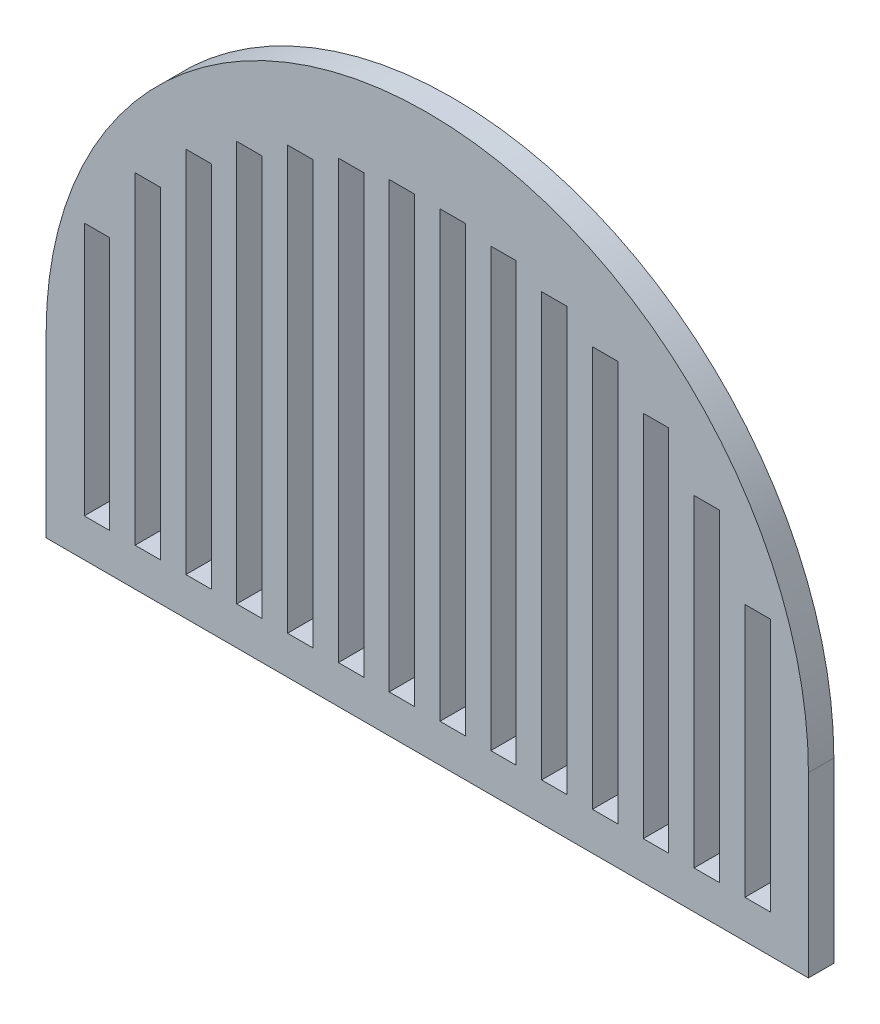
from build123d import *

# Parameters (mm, degrees)
P_IDAT_VYSUNUT_M1_DEPTH  = 10
ODEBRAT_VYSUNUT_M1_REACH = 374.156
SKICA2_W                 = 10
SKICA2_H                 = 99.833147735
LINPOLE2_START           = 15
LINPOLE2_OUTLINE_W       = 10
LINPOLE2_OUTLINE_H       = 10
LINPOLE2_DEPTH           = 126.980390272
LINPOLE2_START_2         = 141.980390272
LINPOLE2_2_OUTLINE_W     = 10
LINPOLE2_2_OUTLINE_H     = 10
LINPOLE2_2_DEPTH         = 30.684601342
LINPOLE2_3_OUTLINE_W     = 10
LINPOLE2_3_OUTLINE_H     = 10
LINPOLE2_3_DEPTH         = 99.833147735
LINPOLE2_START_3         = 172.664991614
LINPOLE2_4_OUTLINE_W     = 10
LINPOLE2_4_OUTLINE_H     = 10
LINPOLE2_4_DEPTH         = 14.304392953
LINPOLE2_5_OUTLINE_W     = 10
LINPOLE2_5_OUTLINE_H     = 10
LINPOLE2_5_DEPTH         = 18.019609728
LINPOLE2_6_OUTLINE_W     = 10
LINPOLE2_6_OUTLINE_H     = 10
LINPOLE2_6_DEPTH         = 8.756364623
LINPOLE2_START_4         = 186.969384567
LINPOLE2_7_OUTLINE_W     = 10
LINPOLE2_7_OUTLINE_H     = 10
LINPOLE2_7_DEPTH         = 2.696910904


# Read off the part's stored shape, not the designer's step: LinPole2
with BuildPart() as part:
    # Skica1 → Přidat vysunutím1 (new body)
    with BuildSketch(Plane.XY):
        with BuildLine():
            Line((0, 0), (0, 70))
            ThreePointArc((0, 70), (150, 220), (300, 70))
            Line((300, 70), (300, 0))
            Line((300, 0), (0, 0))
        make_face()
    extrude(amount=P_IDAT_VYSUNUT_M1_DEPTH)

    # Skica2 → Odebrat vysunutím1 (cut, up to next)
    with BuildSketch(Plane(origin=(0, 0, 0), x_dir=(-1, 0, 0), z_dir=(0, 0, -1)), mode=Mode.PRIVATE) as odebrat_vysunut_m1_sk1:
        with Locations((-280, 64.916573868)):
            Rectangle(SKICA2_W, SKICA2_H)
    odebrat_vysunut_m1_tool1 = extrude(odebrat_vysunut_m1_sk1.sketch, amount=-ODEBRAT_VYSUNUT_M1_REACH, mode=Mode.PRIVATE) & part.part
    add(odebrat_vysunut_m1_tool1.solids().sort_by_distance((280, 64.916574, 0))[0], mode=Mode.SUBTRACT)

    # LinPole2 outline → LinPole2 (cut)
    with BuildSketch(Plane(origin=(0, 0, 0), x_dir=(1, 0, 0), z_dir=(0, 1, 0)).offset(LINPOLE2_START)):
        with Locations((40, -5)):
            Rectangle(LINPOLE2_OUTLINE_W, LINPOLE2_OUTLINE_H)
        with Locations((60, -5)):
            Rectangle(LINPOLE2_OUTLINE_W, LINPOLE2_OUTLINE_H)
        with Locations((80, -5)):
            Rectangle(LINPOLE2_OUTLINE_W, LINPOLE2_OUTLINE_H)
        with Locations((100, -5)):
            Rectangle(LINPOLE2_OUTLINE_W, LINPOLE2_OUTLINE_H)
        with Locations((120, -5)):
            Rectangle(LINPOLE2_OUTLINE_W, LINPOLE2_OUTLINE_H)
        with Locations((140, -5)):
            Rectangle(LINPOLE2_OUTLINE_W, LINPOLE2_OUTLINE_H)
        with Locations((160, -5)):
            Rectangle(LINPOLE2_OUTLINE_W, LINPOLE2_OUTLINE_H)
        with Locations((180, -5)):
            Rectangle(LINPOLE2_OUTLINE_W, LINPOLE2_OUTLINE_H)
        with Locations((200, -5)):
            Rectangle(LINPOLE2_OUTLINE_W, LINPOLE2_OUTLINE_H)
        with Locations((220, -5)):
            Rectangle(LINPOLE2_OUTLINE_W, LINPOLE2_OUTLINE_H)
        with Locations((240, -5)):
            Rectangle(LINPOLE2_OUTLINE_W, LINPOLE2_OUTLINE_H)
        with Locations((260, -5)):
            Rectangle(LINPOLE2_OUTLINE_W, LINPOLE2_OUTLINE_H)
    extrude(amount=LINPOLE2_DEPTH, mode=Mode.SUBTRACT)

    # LinPole2 2 outline → LinPole2 2 (cut)
    with BuildSketch(Plane(origin=(0, 0, 0), x_dir=(1, 0, 0), z_dir=(0, 1, 0)).offset(LINPOLE2_START_2)):
        with Locations((80, -5)):
            Rectangle(LINPOLE2_2_OUTLINE_W, LINPOLE2_2_OUTLINE_H)
        with Locations((100, -5)):
            Rectangle(LINPOLE2_2_OUTLINE_W, LINPOLE2_2_OUTLINE_H)
        with Locations((120, -5)):
            Rectangle(LINPOLE2_2_OUTLINE_W, LINPOLE2_2_OUTLINE_H)
        with Locations((140, -5)):
            Rectangle(LINPOLE2_2_OUTLINE_W, LINPOLE2_2_OUTLINE_H)
        with Locations((160, -5)):
            Rectangle(LINPOLE2_2_OUTLINE_W, LINPOLE2_2_OUTLINE_H)
        with Locations((180, -5)):
            Rectangle(LINPOLE2_2_OUTLINE_W, LINPOLE2_2_OUTLINE_H)
        with Locations((200, -5)):
            Rectangle(LINPOLE2_2_OUTLINE_W, LINPOLE2_2_OUTLINE_H)
        with Locations((220, -5)):
            Rectangle(LINPOLE2_2_OUTLINE_W, LINPOLE2_2_OUTLINE_H)
    extrude(amount=LINPOLE2_2_DEPTH, mode=Mode.SUBTRACT)

    # LinPole2 3 outline → LinPole2 3 (cut)
    with BuildSketch(Plane(origin=(0, 0, 0), x_dir=(1, 0, 0), z_dir=(0, 1, 0)).offset(LINPOLE2_START)):
        with Locations((20, -5)):
            Rectangle(LINPOLE2_3_OUTLINE_W, LINPOLE2_3_OUTLINE_H)
    extrude(amount=LINPOLE2_3_DEPTH, mode=Mode.SUBTRACT)

    # LinPole2 4 outline → LinPole2 4 (cut)
    with BuildSketch(Plane(origin=(0, 0, 0), x_dir=(1, 0, 0), z_dir=(0, 1, 0)).offset(LINPOLE2_START_3)):
        with Locations((120, -5)):
            Rectangle(LINPOLE2_4_OUTLINE_W, LINPOLE2_4_OUTLINE_H)
        with Locations((140, -5)):
            Rectangle(LINPOLE2_4_OUTLINE_W, LINPOLE2_4_OUTLINE_H)
        with Locations((160, -5)):
            Rectangle(LINPOLE2_4_OUTLINE_W, LINPOLE2_4_OUTLINE_H)
        with Locations((180, -5)):
            Rectangle(LINPOLE2_4_OUTLINE_W, LINPOLE2_4_OUTLINE_H)
    extrude(amount=LINPOLE2_4_DEPTH, mode=Mode.SUBTRACT)

    # LinPole2 5 outline → LinPole2 5 (cut)
    with BuildSketch(Plane(origin=(0, 0, 0), x_dir=(1, 0, 0), z_dir=(0, 1, 0)).offset(LINPOLE2_START_2)):
        with Locations((60, -5)):
            Rectangle(LINPOLE2_5_OUTLINE_W, LINPOLE2_5_OUTLINE_H)
        with Locations((240, -5)):
            Rectangle(LINPOLE2_5_OUTLINE_W, LINPOLE2_5_OUTLINE_H)
    extrude(amount=LINPOLE2_5_DEPTH, mode=Mode.SUBTRACT)

    # LinPole2 6 outline → LinPole2 6 (cut)
    with BuildSketch(Plane(origin=(0, 0, 0), x_dir=(1, 0, 0), z_dir=(0, 1, 0)).offset(LINPOLE2_START_3)):
        with Locations((100, -5)):
            Rectangle(LINPOLE2_6_OUTLINE_W, LINPOLE2_6_OUTLINE_H)
        with Locations((200, -5)):
            Rectangle(LINPOLE2_6_OUTLINE_W, LINPOLE2_6_OUTLINE_H)
    extrude(amount=LINPOLE2_6_DEPTH, mode=Mode.SUBTRACT)

    # LinPole2 7 outline → LinPole2 7 (cut)
    with BuildSketch(Plane(origin=(0, 0, 0), x_dir=(1, 0, 0), z_dir=(0, 1, 0)).offset(LINPOLE2_START_4)):
        with Locations((140, -5)):
            Rectangle(LINPOLE2_7_OUTLINE_W, LINPOLE2_7_OUTLINE_H)
        with Locations((160, -5)):
            Rectangle(LINPOLE2_7_OUTLINE_W, LINPOLE2_7_OUTLINE_H)
    extrude(amount=LINPOLE2_7_DEPTH, mode=Mode.SUBTRACT)


solid = part.part
